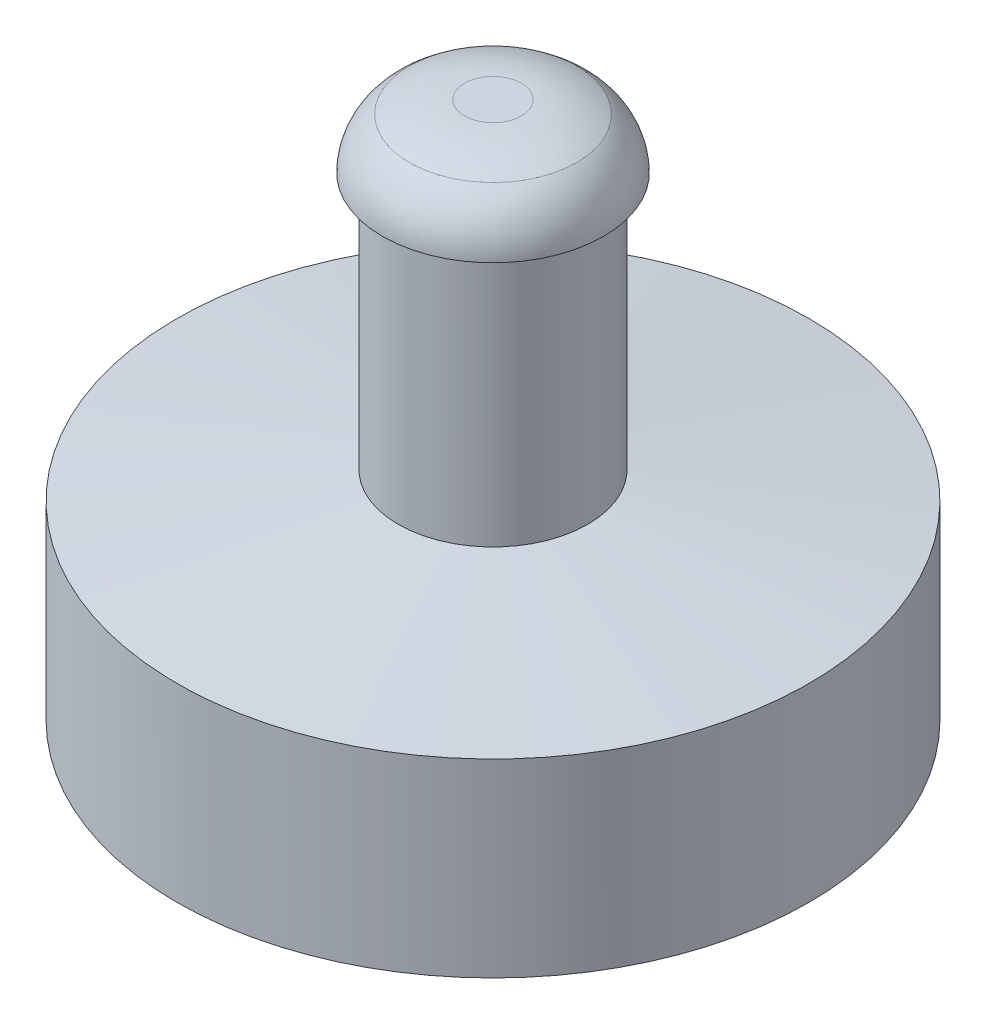
from build123d import *

# Parameters (mm, degrees)
ESBO_O2_R                     = 5
RESSALTO_EXTRUS_O2_DEPTH      = 3.5
CHANFRO1_SIZE                 = 0.5
CHANFRO1_SIZE2                = 4.072173214
RESSALTO_EXTRUS_O3_DEPTH      = 4
RESSALTO_EXTRUS_O3_DEPTH_BACK = 1
ESBO_O3_R                     = 1.5
ESBO_O4_R                     = 1.75
RESSALTO_EXTRUS_O4_DEPTH      = 1
CHANFRO2_SIZE                 = 0.5
CHANFRO2_SIZE2                = 0.714074003
FILETE2_R                     = 1
FILETE3_R                     = 2


with BuildPart() as part:
    # Esboço2 → Ressalto-extrusão2 (new body)
    with BuildSketch(Plane(origin=(0, 0, 0), x_dir=(1, 0, 0), z_dir=(0, 1, 0))):
        with Locations(Location((0, 0, 0), (0, 0, 270))):
            Circle(ESBO_O2_R)
    extrude(amount=RESSALTO_EXTRUS_O2_DEPTH)

    # Chanfro1
    chanfro1_edges = [part.edges().sort_by_distance(p)[0] for p in [
        (0, 3.5, -5),
    ]]
    chanfro1_side = [part.faces().sort_by_distance(p)[0] for p in [
        (0, 1.75, -5),
    ]]
    chamfer(chanfro1_edges, length=CHANFRO1_SIZE, length2=CHANFRO1_SIZE2, reference=chanfro1_side[0])

    # Esboço3 → Ressalto-extrusão3 (add, two sides: drawn at the far end of the back side and taken through both)
    with BuildSketch(Plane(origin=(0, 3.5, 0), x_dir=(1, 0, 0), z_dir=(0, 1, 0)).offset(-RESSALTO_EXTRUS_O3_DEPTH_BACK)):
        with Locations(Location((0, 0, 0), (0, 0, 270))):
            Circle(ESBO_O3_R)
    extrude(amount=RESSALTO_EXTRUS_O3_DEPTH + RESSALTO_EXTRUS_O3_DEPTH_BACK)

    # Esboço4 → Ressalto-extrusão4 (add)
    with BuildSketch(Plane(origin=(0, 7.5, 0), x_dir=(1, 0, 0), z_dir=(0, 1, 0))):
        with Locations(Location((0, 0, 0), (0, 0, 270))):
            Circle(ESBO_O4_R)
    extrude(amount=RESSALTO_EXTRUS_O4_DEPTH)

    # Chanfro2
    chanfro2_edges = [part.edges().sort_by_distance(p)[0] for p in [
        (0, 8.5, -1.75),
    ]]
    chanfro2_side = [part.faces().sort_by_distance(p)[0] for p in [
        (0, 8, -1.75),
    ]]
    chamfer(chanfro2_edges, length=CHANFRO2_SIZE, length2=CHANFRO2_SIZE2, reference=chanfro2_side[0])

    # Filete2
    # the kernel refuses this fillet: 1 mm, written as the material it takes off along each edge
    with BuildSketch(Plane(origin=(0, 8, 0), x_dir=(0, 0, 1), z_dir=(-1, 0, 0))) as filete2_piece_1:
        with BuildLine():
            CenterArc((1.75 - FILETE2_R, -FILETE2_R * 0.520567050552), FILETE2_R, 0, 55)
            Line((1.75 - FILETE2_R * 0.426423563649, FILETE2_R * 0.298584993737), (1.75, 0))
            Line((1.75, 0), (1.75, -FILETE2_R * 0.520567050552))
        make_face()
    revolve(axis=Axis((0, 8, 0), (0, 1, 0)), mode=Mode.SUBTRACT)

    # Filete3
    # the kernel refuses this fillet: 2 mm, written as the material it takes off along each edge
    with BuildSketch(Plane(origin=(0, 8.5, 0), x_dir=(0, 0, 1), z_dir=(-1, 0, 0))) as filete3_piece_1:
        with BuildLine():
            CenterArc((0.448881049, -2), FILETE3_R, 64.065224384, 25.934775616)
            Line((0.448881049, 0), (0.448881049, 0.04))
            Line((0.448881049, 0.04), (1.035925997, 0.04))
            Line((1.035925997, 0.04), (1.058869054, 0.032766082))
            ThreePointArc((1.058869054, 0.032766082), (1.202694274, -0.067941421), (1.341070344, -0.165443306))
            Line((1.341070344, -0.165443306), (1.323576436, -0.201415006))
        make_face()
    revolve(axis=Axis((0, 8.5, 0), (0, 1, 0)), mode=Mode.SUBTRACT)


solid = part.part
